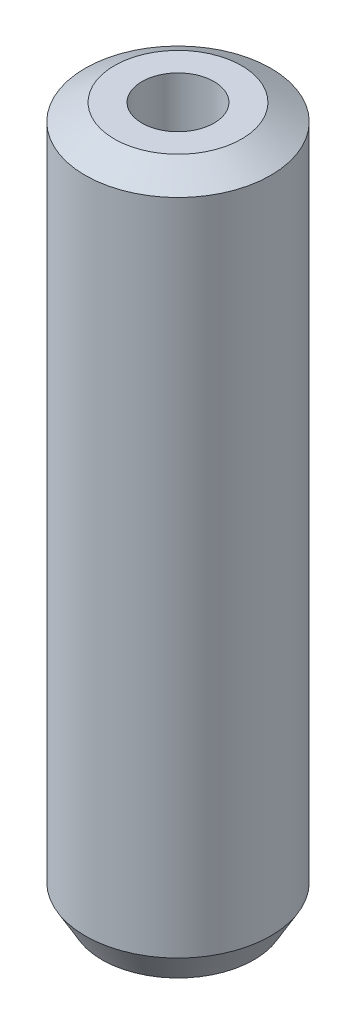
from build123d import *
from OCP.BRepFilletAPI import BRepFilletAPI_MakeChamfer

# Parameters (mm, degrees)
SKETCH1_R           = 22.5
BOSS_EXTRUDE1_DEPTH = 170.851390214
SKETCH2_R           = 8.742069635
CUT_EXTRUDE1_DEPTH  = 174.78923309
CHAMFER1_SIZE       = 4.084375876
CHAMFER1_SIZE2      = 7.074346534


with BuildPart() as part:
    # Sketch1 → Boss-Extrude1 (new body)
    with BuildSketch(Plane(origin=(0, 0, 0), x_dir=(1, 0, 0), z_dir=(0, 1, 0))):
        Circle(SKETCH1_R)
    extrude(amount=BOSS_EXTRUDE1_DEPTH)

    # Sketch2 → Cut-Extrude1 (cut, through all)
    with BuildSketch(Plane(origin=(0, 0, 0), x_dir=(1, 0, 0), z_dir=(0, 1, 0))):
        Circle(SKETCH2_R)
    extrude(amount=CUT_EXTRUDE1_DEPTH, mode=Mode.SUBTRACT)

    # Chamfer1: one chamfer whose edges measure the first distance from different faces: ONE call of the kernel's chamfer builder (chamfer() names one face for all edges)
    chamfer1_edges_1 = [part.edges().sort_by_distance(p)[0] for p in [
        (-22.5, 170.851390214, 0),
    ]]
    chamfer1_side_1 = [part.faces().sort_by_distance(p)[0] for p in [
        (-22.5, 85.425695107, 0),
    ]]
    chamfer1_edges_2 = [part.edges().sort_by_distance(p)[0] for p in [
        (-22.5, 0, 0),
    ]]
    chamfer1_side_2 = [part.faces().sort_by_distance(p)[0] for p in [
        (-21.863603897, 0, 0),
    ]]
    chamfer1 = BRepFilletAPI_MakeChamfer(part.part.solid().wrapped)
    for e in chamfer1_edges_1:
        chamfer1.Add(CHAMFER1_SIZE, CHAMFER1_SIZE2, e.wrapped, chamfer1_side_1[0].wrapped)  # the first distance lies on this face
    for e in chamfer1_edges_2:
        chamfer1.Add(CHAMFER1_SIZE, CHAMFER1_SIZE2, e.wrapped, chamfer1_side_2[0].wrapped)  # the first distance lies on this face
    add(Compound.cast(chamfer1.Shape()), mode=Mode.REPLACE)


solid = part.part
